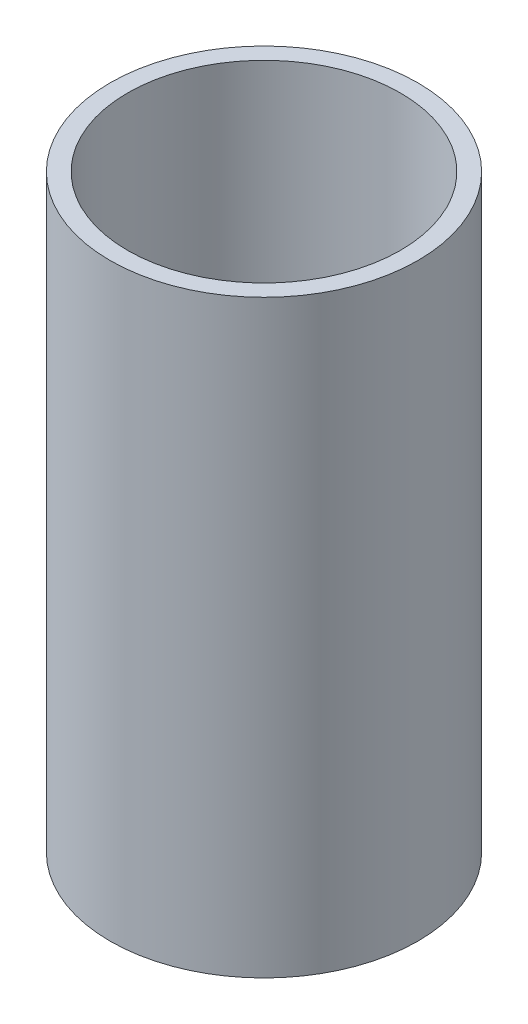
from build123d import *

# Parameters (mm, degrees)
SKETCH1_R           = 37.5
BOSS_EXTRUDE1_DEPTH = 143.640134596
SKETCH2_R           = 33.237057265
CUT_EXTRUDE1_DEPTH  = 154.117563548


with BuildPart() as part:
    # Sketch1 → Boss-Extrude1 (new body)
    with BuildSketch(Plane(origin=(0, 0, 0), x_dir=(1, 0, 0), z_dir=(0, 1, 0))):
        Circle(SKETCH1_R)
    extrude(amount=BOSS_EXTRUDE1_DEPTH)

    # Sketch2 → Cut-Extrude1 (cut, through all)
    with BuildSketch(Plane(origin=(0, 0, 0), x_dir=(1, 0, 0), z_dir=(0, 1, 0))):
        Circle(SKETCH2_R)
    extrude(amount=CUT_EXTRUDE1_DEPTH, mode=Mode.SUBTRACT)


solid = part.part
